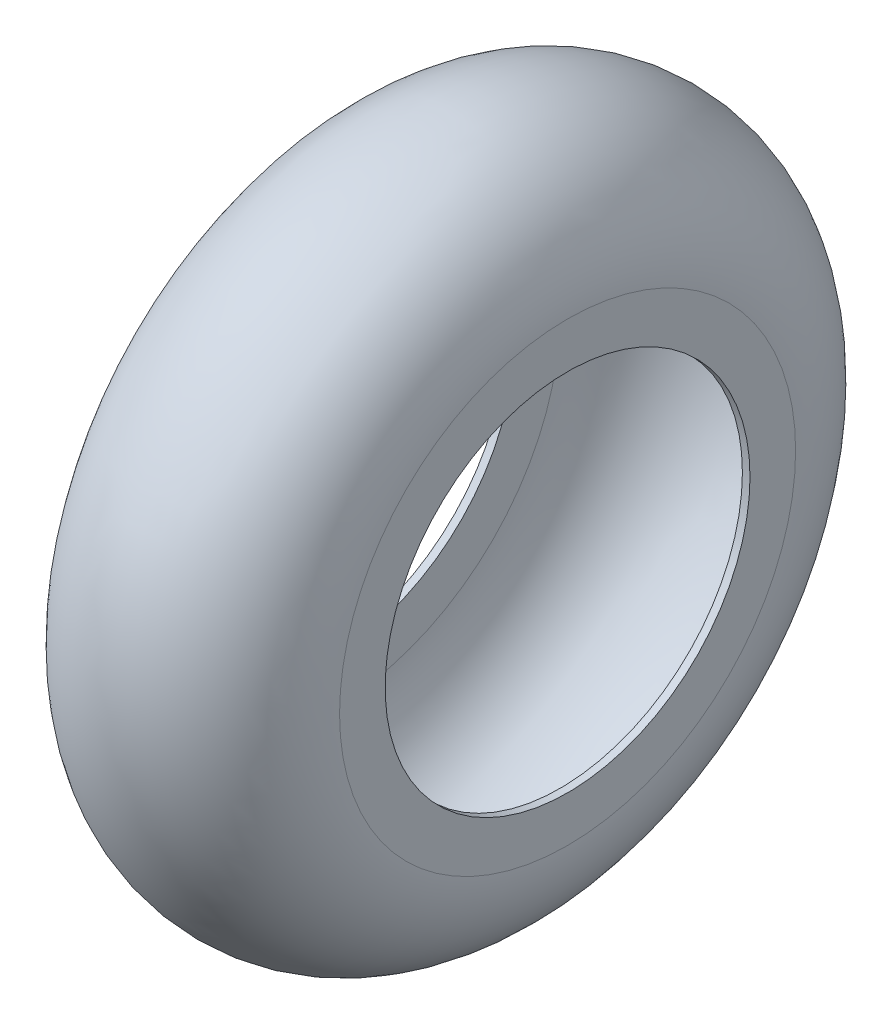
from build123d import *

# Parameters (mm, degrees)
SKETCH2_R           = 292.1
SKETCH2_R_2         = 152.4
BOSS_EXTRUDE1_DEPTH = 203.2
FILLET1_R           = 101.6
SHELL1_T            = -6.35


with BuildPart() as part:
    # Sketch2 → Boss-Extrude1 (new body)
    with BuildSketch(Plane(origin=(0, 0, 0), x_dir=(0, 0, -1), z_dir=(1, 0, 0))):
        Circle(SKETCH2_R)
        Circle(SKETCH2_R_2, mode=Mode.SUBTRACT)
    extrude(amount=-BOSS_EXTRUDE1_DEPTH)

    # Fillet1
    fillet1_edges = [part.edges().sort_by_distance(p)[0] for p in [
        (0, 0, 292.1),
        (-203.2, 0, 292.1),
    ]]
    fillet(fillet1_edges, radius=FILLET1_R - 0.0001)  # a hair under: the kernel refuses the full size

    # Shell1
    shell1_openings = [part.faces().sort_by_distance(p)[0] for p in [
        (-101.6, 0, 152.4),
    ]]
    offset(amount=SHELL1_T, openings=shell1_openings, kind=Kind.INTERSECTION)


solid = part.part
